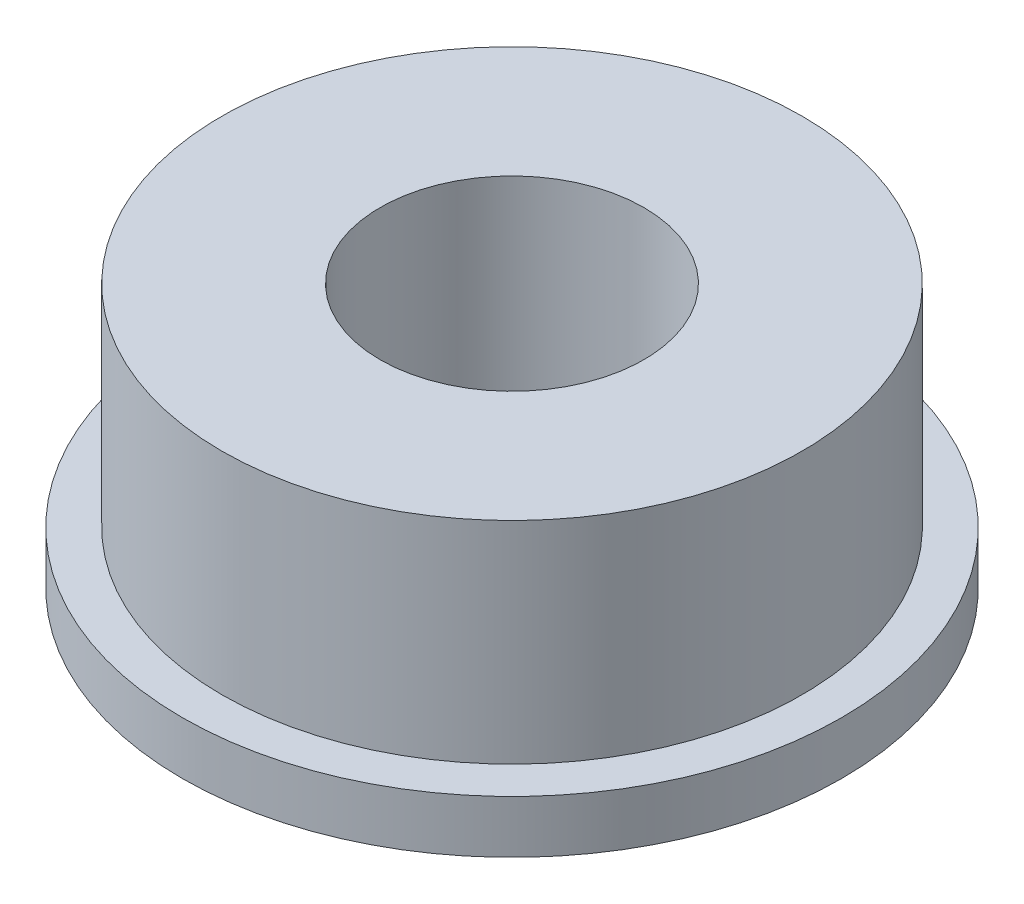
from build123d import *

# Parameters (mm, degrees)
SKETCH1_R           = 5.5
SKETCH1_R_2         = 2.5
BOSS_EXTRUDE1_DEPTH = 4
BOSS_EXTRUDE2_START = 1
SKETCH2_R           = 6.25
SKETCH2_R_2         = 2.5
BOSS_EXTRUDE2_DEPTH = 1


with BuildPart() as part:
    # Sketch1 → Boss-Extrude1 (new body)
    with BuildSketch(Plane(origin=(0, 0, 0), x_dir=(1, 0, 0), z_dir=(0, 1, 0))):
        Circle(SKETCH1_R)
        Circle(SKETCH1_R_2, mode=Mode.SUBTRACT)
    extrude(amount=BOSS_EXTRUDE1_DEPTH)

    # Sketch2 → Boss-Extrude2 (add)
    with BuildSketch(Plane.XZ.offset(BOSS_EXTRUDE2_START)):
        Circle(SKETCH2_R)
        Circle(SKETCH2_R_2, mode=Mode.SUBTRACT)
    extrude(amount=-BOSS_EXTRUDE2_DEPTH)


solid = part.part
